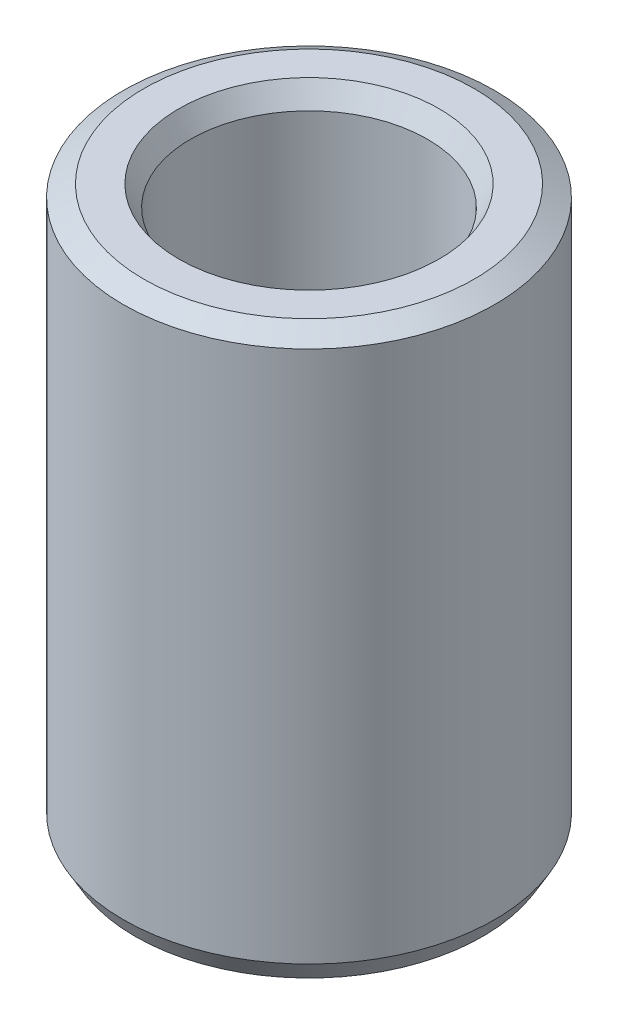
from build123d import *
from OCP.BRepFilletAPI import BRepFilletAPI_MakeChamfer

# Parameters (mm, degrees)
SKETCH1_R           = 60
BOSS_EXTRUDE1_DEPTH = 182.612738522
SKETCH2_R           = 38.277863862
CUT_EXTRUDE1_DEPTH  = 202.363880253
CHAMFER1_SIZE       = 3.816477406
CHAMFER1_SIZE2      = 6.610332772


with BuildPart() as part:
    # Sketch1 → Boss-Extrude1 (new body)
    with BuildSketch(Plane(origin=(0, 0, 0), x_dir=(1, 0, 0), z_dir=(0, 1, 0))):
        Circle(SKETCH1_R)
    extrude(amount=BOSS_EXTRUDE1_DEPTH)

    # Sketch2 → Cut-Extrude1 (cut, through all)
    with BuildSketch(Plane(origin=(0, 0, 0), x_dir=(1, 0, 0), z_dir=(0, 1, 0))):
        Circle(SKETCH2_R)
    extrude(amount=CUT_EXTRUDE1_DEPTH, mode=Mode.SUBTRACT)

    # Chamfer1: one chamfer whose edges measure the first distance from different faces: ONE call of the kernel's chamfer builder (chamfer() names one face for all edges)
    chamfer1_edges_1 = [part.edges().sort_by_distance(p)[0] for p in [
        (-38.277863862, 182.612738522, 0),
    ]]
    chamfer1_side_1 = [part.faces().sort_by_distance(p)[0] for p in [
        (-58.302943725, 182.612738522, 0),
    ]]
    chamfer1_edges_2 = [part.edges().sort_by_distance(p)[0] for p in [
        (-38.277863862, 0, 0),
    ]]
    chamfer1_side_2 = [part.faces().sort_by_distance(p)[0] for p in [
        (-38.277863862, 91.306369261, 0),
    ]]
    chamfer1_edges_3 = [part.edges().sort_by_distance(p)[0] for p in [
        (-60, 0, 0),
    ]]
    chamfer1_side_3 = [part.faces().sort_by_distance(p)[0] for p in [
        (-58.302943725, 0, 0),
    ]]
    chamfer1_edges_4 = [part.edges().sort_by_distance(p)[0] for p in [
        (-60, 182.612738522, 0),
    ]]
    chamfer1_side_4 = [part.faces().sort_by_distance(p)[0] for p in [
        (-60, 91.306369261, 0),
    ]]
    chamfer1 = BRepFilletAPI_MakeChamfer(part.part.solid().wrapped)
    for e in chamfer1_edges_1:
        chamfer1.Add(CHAMFER1_SIZE, CHAMFER1_SIZE2, e.wrapped, chamfer1_side_1[0].wrapped)  # the first distance lies on this face
    for e in chamfer1_edges_2:
        chamfer1.Add(CHAMFER1_SIZE, CHAMFER1_SIZE2, e.wrapped, chamfer1_side_2[0].wrapped)  # the first distance lies on this face
    for e in chamfer1_edges_3:
        chamfer1.Add(CHAMFER1_SIZE, CHAMFER1_SIZE2, e.wrapped, chamfer1_side_3[0].wrapped)  # the first distance lies on this face
    for e in chamfer1_edges_4:
        chamfer1.Add(CHAMFER1_SIZE, CHAMFER1_SIZE2, e.wrapped, chamfer1_side_4[0].wrapped)  # the first distance lies on this face
    add(Compound.cast(chamfer1.Shape()), mode=Mode.REPLACE)


solid = part.part
